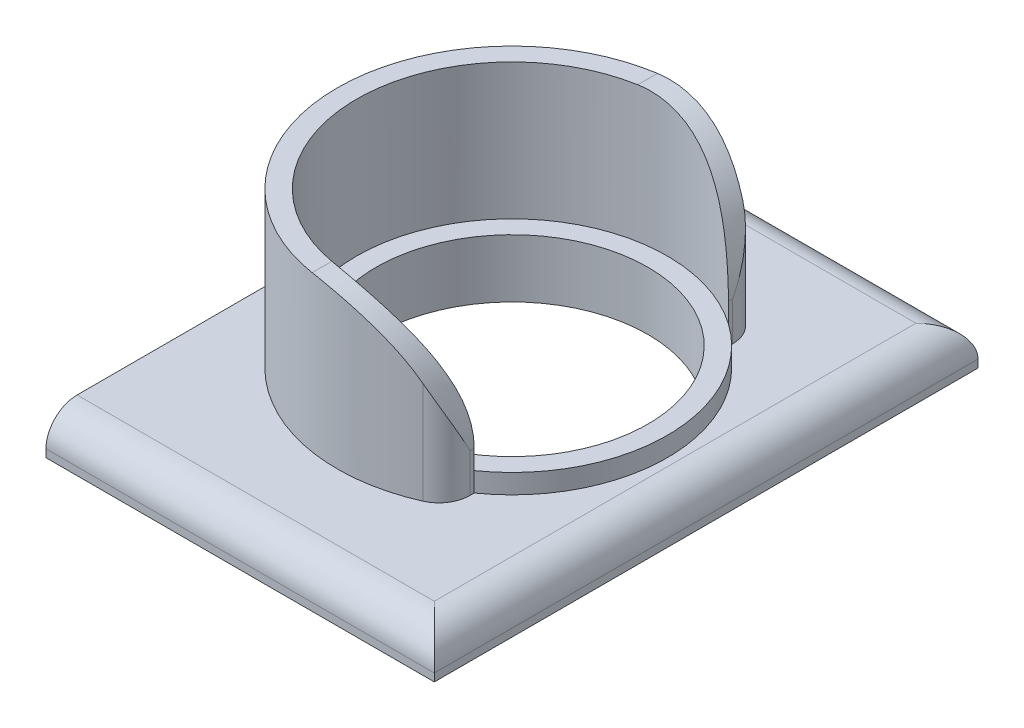
from build123d import *

# Parameters (mm, degrees)
CROQUIS3_W                 = 300
CROQUIS3_H                 = 140
SALIENTE_EXTRUIR1_DEPTH    = 10
CROQUIS5_R                 = 40
CROQUIS5_R_2               = 35
SALIENTE_EXTRUIR2_DEPTH    = 5
SALIENTE_EXTRUIR5_DEPTH    = 40
REDONDEO3_START            = -46
REDONDEO3_DEPTH            = 13.273863656
REDONDEO4_START            = -44.452221542
REDONDEO4_DEPTH            = 90.452221542
CORTAR_EXTRUIR1_START      = -40
CROQUIS7_R                 = 35
CORTAR_EXTRUIR1_DEPTH      = 40
MATRIZL1_COUNT             = 3
MATRIZL1_PITCH             = 100
CORTAR_EXTRUIR3_DEPTH      = 171.293863683
CORTAR_EXTRUIR3_DEPTH_BACK = 171.293863683
CROQUIS10_W                = 200
CROQUIS10_H                = 140
CROQUIS12_R                = 4
CORTAR_EXTRUIR4_DEPTH      = 30
REDONDEO5_R                = 8


with BuildPart() as part:
    # Croquis3 → Saliente-Extruir1 (new body)
    with BuildSketch(Plane(origin=(0, 0, 0), x_dir=(1, 0, 0), z_dir=(0, 1, 0))):
        Rectangle(CROQUIS3_W, CROQUIS3_H)
    extrude(amount=SALIENTE_EXTRUIR1_DEPTH)

    # Croquis5 → Saliente-Extruir2 (add)
    # profile 1 of 3: a face of its own
    with BuildSketch(Plane(origin=(0, 10, 0), x_dir=(1, 0, 0), z_dir=(0, 1, 0))):
        with Locations(Location((-100, 0, 0), (0, 0, 270))):
            Circle(CROQUIS5_R)
        with Locations(Location((-100, 0, 0), (0, 0, 270))):
            Circle(CROQUIS5_R_2, mode=Mode.SUBTRACT)
    # profile 2 of 3: a face of its own
    with BuildSketch(Plane(origin=(0, 10, 0), x_dir=(1, 0, 0), z_dir=(0, 1, 0))):
        with Locations(Location((0, 0, 0), (0, 0, 270))):
            Circle(CROQUIS5_R)
        with Locations(Location((0, 0, 0), (0, 0, 270))):
            Circle(CROQUIS5_R_2, mode=Mode.SUBTRACT)
    # profile 3 of 3: a face of its own
    with BuildSketch(Plane(origin=(0, 10, 0), x_dir=(1, 0, 0), z_dir=(0, 1, 0))):
        with Locations(Location((100, 0, 0), (0, 0, 270))):
            Circle(CROQUIS5_R)
        with Locations(Location((100, 0, 0), (0, 0, 270))):
            Circle(CROQUIS5_R_2, mode=Mode.SUBTRACT)
    extrude(amount=SALIENTE_EXTRUIR2_DEPTH)

    # Croquis6 → Saliente-Extruir5 (add)
    with BuildSketch(Plane(origin=(0, 10, 0), x_dir=(1, 0, 0), z_dir=(0, 1, 0))):
        with BuildLine():
            Line((-77, 33.823069051), (-77, 32.726136344))
            ThreePointArc((-77, 32.726136344), (-140, 0), (-77, -32.726136344))
            Line((-77, -32.726136344), (-77, -33.823069051))
            ThreePointArc((-77, -33.823069051), (-78.293810846, -38.185067105), (-81.756756757, -41.136165062))
            ThreePointArc((-81.756756757, -41.136165062), (-145, 0), (-81.756756757, 41.136165062))
            ThreePointArc((-81.756756757, 41.136165062), (-78.293810846, 38.185067105), (-77, 33.823069051))
        make_face()
    saliente_extruir5 = extrude(amount=SALIENTE_EXTRUIR5_DEPTH)

    # Redondeo3: read off the stored shape, not the designer's step
    # Redondeo3 outline → Redondeo3 (cut)
    with BuildSketch(Plane.XY.offset(REDONDEO3_START)):
        with BuildLine():
            ThreePointArc((-107.000000862, 50), (-85.786796869, 41.21320374), (-77, 20))
            Line((-77, 20), (-77, 50))
            Line((-77, 50), (-107.000000862, 50))
        make_face()
    redondeo3 = extrude(amount=REDONDEO3_DEPTH, mode=Mode.SUBTRACT)

    # Redondeo4: read off the stored shape, not the designer's step
    # Redondeo4 outline → Redondeo4 (cut)
    with BuildSketch(Plane.XY.offset(REDONDEO4_START)):
        with BuildLine():
            ThreePointArc((-107.000000862, 50), (-85.786796869, 41.21320374), (-77, 20))
            Line((-77, 20), (-77, 50))
            Line((-77, 50), (-107.000000862, 50))
        make_face()
    redondeo4 = extrude(amount=REDONDEO4_DEPTH, mode=Mode.SUBTRACT)

    # Croquis7 → Cortar-Extruir1 (cut)
    with BuildSketch(Plane(origin=(0, 10, 0), x_dir=(1, 0, 0), z_dir=(0, 1, 0)).offset(CORTAR_EXTRUIR1_START)):
        with Locations(Location((-100, 0, 0), (0, 0, 270))):
            Circle(CROQUIS7_R)
    cortar_extruir1 = extrude(amount=CORTAR_EXTRUIR1_DEPTH, mode=Mode.SUBTRACT)

    # MatrizL1: Saliente-Extruir5, Redondeo3, Redondeo4, Cortar-Extruir1 ×3
    with Locations(*[(i * MATRIZL1_PITCH, 0, 0) for i in range(1, MATRIZL1_COUNT)]):
        add(saliente_extruir5)
        add(redondeo3, mode=Mode.SUBTRACT)
        add(redondeo4, mode=Mode.SUBTRACT)
        add(cortar_extruir1, mode=Mode.SUBTRACT)

    # Croquis10 → Cortar-Extruir3 (cut, two sides: drawn at the far end of the back side and taken through both)
    with BuildSketch(Plane(origin=(0, 10, 0), x_dir=(1, 0, 0), z_dir=(0, 1, 0)).offset(-CORTAR_EXTRUIR3_DEPTH_BACK)):
        with Locations((50, 0)):
            Rectangle(CROQUIS10_W, CROQUIS10_H)
    extrude(amount=CORTAR_EXTRUIR3_DEPTH + CORTAR_EXTRUIR3_DEPTH_BACK, mode=Mode.SUBTRACT)

    # Croquis12 → Cortar-Extruir4 (cut)
    with BuildSketch(Plane.ZY.offset(150)):
        with Locations((-50, 5)):
            Circle(CROQUIS12_R)
        with Locations((50, 5)):
            Circle(CROQUIS12_R)
    extrude(amount=-CORTAR_EXTRUIR4_DEPTH, mode=Mode.SUBTRACT)

    # Redondeo5
    redondeo5_edges = [part.edges().sort_by_distance(p)[0] for p in [
        (-100, 10, -70),
        (-50, 10, 0),
        (-100, 10, 70),
    ]]
    fillet(redondeo5_edges, radius=REDONDEO5_R)


solid = part.part
